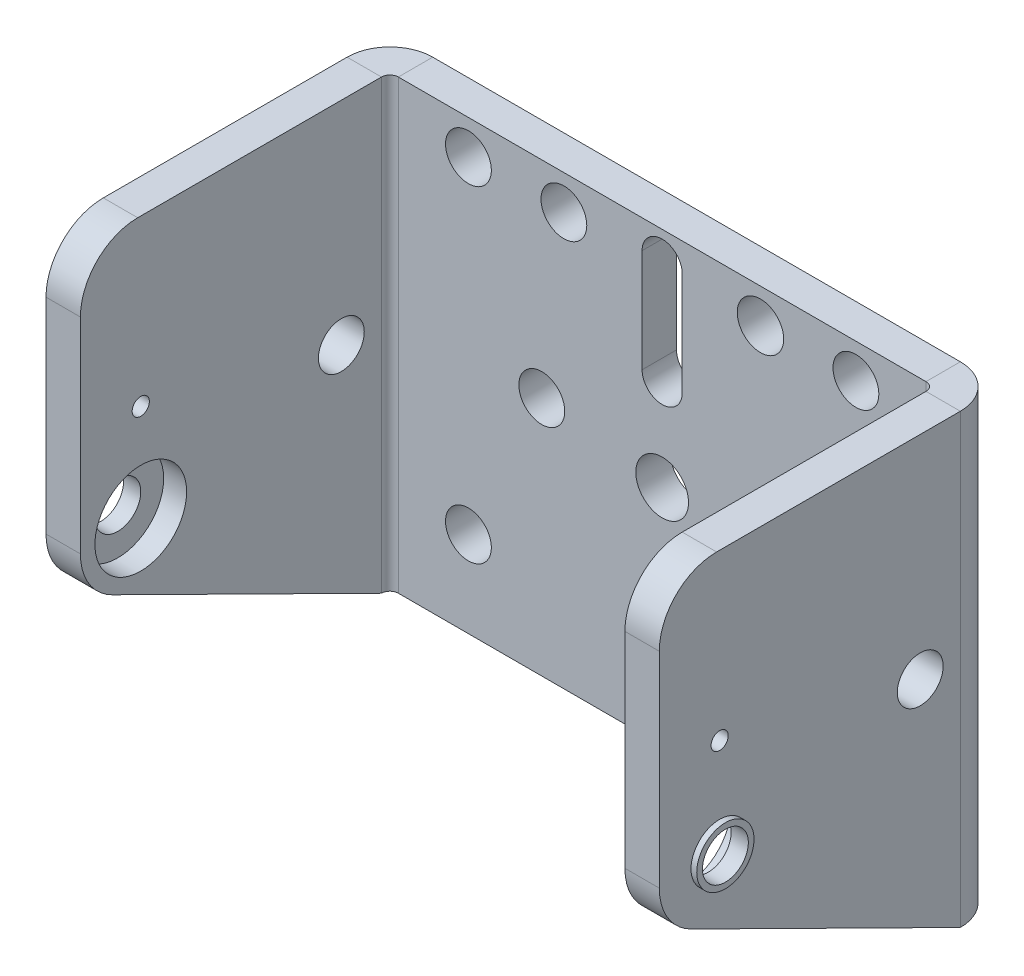
from build123d import *

# Parameters (mm, degrees)
ESBO_O1_W                        = 47.5
ESBO_O1_H                        = 39
FLANGE_BASE1_DEPTH               = 3
ESBO_O6_R                        = 2.3
CORTE_EXTRUS_O1_DEPTH            = 10
ARESTA_FLANGE1_STRIP_W           = 13.4732
ARESTA_FLANGE1_STRIP_H           = 3
ARESTA_FLANGE1_STRIP_CUT_DEPTH   = 39
ARESTA_FLANGE1_STRIP_2_W         = 13.4732
ARESTA_FLANGE1_STRIP_2_H         = 3
ARESTA_FLANGE1_STRIP_CUT_2_DEPTH = 39
ARESTA_FLANGE1_DEPTH             = 39
ARESTA_FLANGE1_BEND_DEPTH        = 39
ESBO_O13_R                       = 2
ESBO_O13_R_2                     = 0.75
CORTE_EXTRUS_O2_DEPTH            = 70
FILETE1_R                        = 5
ESBO_O14_R                       = 1.997873176
ESBO_O14_R_2                     = 2.026064888
ESBO_O14_R_3                     = 2
CORTE_EXTRUS_O4_DEPTH            = 3
BOSS_EXTRUDE1_START              = 0.5
SKETCH1_R                        = 2.5
SKETCH1_R_2                      = 2
BOSS_EXTRUDE1_DEPTH              = 0.5
SKETCH2_R                        = 4
CUT_EXTRUDE8_DEPTH               = 2
CORTE_EXTRUS_O5_REACH            = 66.966
ESBO_O15_R                       = 2


# Sheet-metal steps are written as plain solids
with BuildPart() as part:
    # Esboço1 → Flange-base1 (new body)
    with BuildSketch(Plane.XY):
        with Locations((3.243735783, -4.490936556)):
            Rectangle(ESBO_O1_W, ESBO_O1_H)
    extrude(amount=-FLANGE_BASE1_DEPTH)

    # Esboço6 → Corte-extrusão1 (cut)
    with BuildSketch(Plane.XY):
        with BuildLine():
            Line((-13.656264217, 10.009063444), (-13.656264217, 12.009063444))
            Line((-13.656264217, 12.009063444), (-11.656264217, 12.009063444))
            ThreePointArc((-11.656264217, 12.009063444), (-15.070477779, 13.423277006), (-13.656264217, 10.009063444))
        make_face()
        with BuildLine():
            Line((-11.656264217, 12.009063444), (-13.656264217, 12.009063444))
            Line((-13.656264217, 12.009063444), (-13.656264217, 10.009063444))
            ThreePointArc((-13.656264217, 10.009063444), (-12.242050654, 10.594849882), (-11.656264217, 12.009063444))
        make_face()
        with BuildLine():
            ThreePointArc((-11.656264217, -16.490936556), (-12.242050654, -15.076722994), (-13.656264217, -14.490936556))
            Line((-13.656264217, -14.490936556), (-13.656264217, -16.490936556))
            Line((-13.656264217, -16.490936556), (-11.656264217, -16.490936556))
        make_face()
        with BuildLine():
            Line((-13.656264217, -16.490936556), (-13.656264217, -14.490936556))
            ThreePointArc((-13.656264217, -14.490936556), (-15.070477779, -17.905150118), (-11.656264217, -16.490936556))
            Line((-11.656264217, -16.490936556), (-13.656264217, -16.490936556))
        make_face()
        with Locations((3.243735783, -4.490936556)):
            Circle(ESBO_O6_R)
        with BuildLine():
            Line((4.993735783, 12.009063444), (1.493735783, 12.009063444))
            Line((1.493735783, 12.009063444), (1.493735783, 3.523823043))
            ThreePointArc((1.493735783, 3.523823043), (3.243735783, 1.773823043), (4.993735783, 3.523823043))
            Line((4.993735783, 3.523823043), (4.993735783, 12.009063444))
        make_face()
        with BuildLine():
            Line((1.493735783, 12.523823043), (1.493735783, 12.009063444))
            Line((1.493735783, 12.009063444), (4.993735783, 12.009063444))
            Line((4.993735783, 12.009063444), (4.993735783, 12.523823043))
            ThreePointArc((4.993735783, 12.523823043), (3.243735783, 14.273823043), (1.493735783, 12.523823043))
        make_face()
        with BuildLine():
            Line((1.493735783, -12.505696155), (1.493735783, -16.490936556))
            Line((1.493735783, -16.490936556), (4.993735783, -16.490936556))
            Line((4.993735783, -16.490936556), (4.993735783, -12.505696155))
            ThreePointArc((4.993735783, -12.505696155), (3.243735783, -10.755696155), (1.493735783, -12.505696155))
        make_face()
        with BuildLine():
            Line((4.993735783, -16.490936556), (1.493735783, -16.490936556))
            Line((1.493735783, -16.490936556), (1.493735783, -21.505696155))
            ThreePointArc((1.493735783, -21.505696155), (3.243735783, -23.255696155), (4.993735783, -21.505696155))
            Line((4.993735783, -21.505696155), (4.993735783, -16.490936556))
        make_face()
        with BuildLine():
            ThreePointArc((22.143735783, -16.490936556), (21.557949346, -15.076722994), (20.143735783, -14.490936556))
            Line((20.143735783, -14.490936556), (20.143735783, -16.490936556))
            Line((20.143735783, -16.490936556), (18.143735783, -16.490936556))
            ThreePointArc((18.143735783, -16.490936556), (20.143735783, -18.490936556), (22.143735783, -16.490936556))
        make_face()
        with BuildLine():
            Line((20.143735783, -16.490936556), (20.143735783, -14.490936556))
            ThreePointArc((20.143735783, -14.490936556), (18.729522221, -15.076722994), (18.143735783, -16.490936556))
            Line((18.143735783, -16.490936556), (20.143735783, -16.490936556))
        make_face()
        with BuildLine():
            ThreePointArc((22.143735783, 12.009063444), (20.143735783, 14.009063444), (18.143735783, 12.009063444))
            Line((18.143735783, 12.009063444), (20.143735783, 12.009063444))
            Line((20.143735783, 12.009063444), (20.143735783, 10.009063444))
            ThreePointArc((20.143735783, 10.009063444), (21.557949346, 10.594849882), (22.143735783, 12.009063444))
        make_face()
        with BuildLine():
            Line((20.143735783, 12.009063444), (18.143735783, 12.009063444))
            ThreePointArc((18.143735783, 12.009063444), (18.729522221, 10.594849882), (20.143735783, 10.009063444))
            Line((20.143735783, 10.009063444), (20.143735783, 12.009063444))
        make_face()
    extrude(amount=-CORTE_EXTRUS_O1_DEPTH, mode=Mode.SUBTRACT)

    # Aresta-Flange1 strip (across the edge) → Aresta-Flange1 strip cut (cut)
    with BuildSketch(Plane(origin=(26.993735783, -23.990936556, 0), x_dir=(-1, 0, 0), z_dir=(0, 1, 0))):
        with Locations((-6, -1.5)):
            Rectangle(ARESTA_FLANGE1_STRIP_W, ARESTA_FLANGE1_STRIP_H)
    extrude(amount=ARESTA_FLANGE1_STRIP_CUT_DEPTH, mode=Mode.SUBTRACT)

    # Aresta-Flange1 strip 2 (across the edge) → Aresta-Flange1 strip cut 2 (cut)
    with BuildSketch(Plane(origin=(-20.506264217, 15.009063444, 0), x_dir=(1, 0, 0), z_dir=(0, -1, 0))):
        with Locations((-6, -1.5)):
            Rectangle(ARESTA_FLANGE1_STRIP_2_W, ARESTA_FLANGE1_STRIP_2_H)
    extrude(amount=ARESTA_FLANGE1_STRIP_CUT_2_DEPTH, mode=Mode.SUBTRACT)

    # Aresta-Flange1 section (across the edge) → Aresta-Flange1 (add)
    with BuildSketch(Plane(origin=(26.993735783, -23.990936556, 0), x_dir=(-1, 0, 0), z_dir=(0, 1, 0))):
        with BuildLine():
            Line((-3, 0.7366), (-3, 27))
            Line((-3, 27), (0, 27))
            Line((0, 27), (0, 0.7366))
            ThreePointArc((0, 0.7366), (0.215745145, 0.215745145), (0.7366, 0))
            Line((0.7366, 0), (0.7366, -3))
            ThreePointArc((0.7366, -3), (-1.905575199, -1.905575199), (-3, 0.7366))
        make_face()
    extrude(amount=ARESTA_FLANGE1_DEPTH)

    # Aresta-Flange1 section 2 (across the edge) → Aresta-Flange1 bend (add)
    with BuildSketch(Plane(origin=(-20.506264217, 15.009063444, 0), x_dir=(1, 0, 0), z_dir=(0, -1, 0))):
        with BuildLine():
            Line((-3, 0.7366), (-3, 27))
            Line((-3, 27), (0, 27))
            Line((0, 27), (0, 0.7366))
            ThreePointArc((0, 0.7366), (0.215745145, 0.215745145), (0.7366, 0))
            Line((0.7366, 0), (0.7366, -3))
            ThreePointArc((0.7366, -3), (-1.905575199, -1.905575199), (-3, 0.7366))
        make_face()
    extrude(amount=ARESTA_FLANGE1_BEND_DEPTH)

    # Esboço13 → Corte-extrusão2 (cut)
    with BuildSketch(Plane.ZY.offset(23.506264217)):
        with Locations((21.734737, -7.820936556)):
            Circle(ESBO_O13_R)
        with Locations((21.734737, 0.629063444)):
            Circle(ESBO_O13_R_2)
        Polygon((0.7366, -23.990936556), (27, -23.990936556), (27, -10.990936556), align=None)
    extrude(amount=-CORTE_EXTRUS_O2_DEPTH, mode=Mode.SUBTRACT)

    # Filete1
    filete1_edges = [part.edges().sort_by_distance(p)[0] for p in [
        (28.493735783, 15.009063444, 27),
        (-22.006264217, 15.009063444, 27),
        (-22.006264217, -10.990936556, 27),
        (28.493735783, -10.990936556, 27),
    ]]
    fillet(filete1_edges, radius=FILETE1_R)

    # Esboço14 → Corte-extrusão4 (cut)
    with BuildSketch(Plane.XY):
        with Locations((-5.331264217, 12.009063444)):
            Circle(ESBO_O14_R)
        with Locations((11.818735783, 12.009063444)):
            Circle(ESBO_O14_R_2)
        with Locations((13.743735783, -2.990936556)):
            Circle(ESBO_O14_R_3)
        with Locations(Location((-7.256264217, -2.990936556, 0), (0, 0, 180))):
            Circle(ESBO_O14_R_3)
    extrude(amount=-CORTE_EXTRUS_O4_DEPTH, mode=Mode.SUBTRACT)

    # Sketch1 → Boss-Extrude1 (add)
    with BuildSketch(Plane.ZY.offset(23.506264217).offset(BOSS_EXTRUDE1_START)):
        with Locations(Location((21.734737, -7.820936556, 0), (0, 0, 180))):
            Circle(SKETCH1_R)
        with Locations((21.734737, -7.820936556)):
            Circle(SKETCH1_R_2, mode=Mode.SUBTRACT)
    boss_extrude1 = extrude(amount=-BOSS_EXTRUDE1_DEPTH)

    # Sketch2 → Cut-Extrude8 (cut)
    with BuildSketch(Plane(origin=(-20.506264217, 0, 0), x_dir=(0, 0, -1), z_dir=(1, 0, 0))):
        with Locations((-21.734737, -7.820936556)):
            Circle(SKETCH2_R)
    cut_extrude8 = extrude(amount=-CUT_EXTRUDE8_DEPTH, mode=Mode.SUBTRACT)

    # Mirror1: Boss-Extrude1, Cut-Extrude8 across plane
    add(boss_extrude1.mirror(Plane.ZY.offset(-3.243735783)))
    add(cut_extrude8.mirror(Plane.ZY.offset(-3.243735783)), mode=Mode.SUBTRACT)

    # Corte-extrusão5: up to this face of the body (flat: up to its plane)
    corte_extrus_o5_end = Plane(part.part.faces().sort_by_distance((-23.506264217, -1.392336246, 12.655784695))[0])
    # Esboço15 → Corte-extrusão5 (cut, up to the picked face)
    with BuildSketch(Plane(origin=(29.993735783, 0, 0), x_dir=(0, 0, -1), z_dir=(1, 0, 0)), mode=Mode.PRIVATE) as corte_extrus_o5_sk1:
        with Locations((-4.2366, -3.490936556)):
            Circle(ESBO_O15_R)
    corte_extrus_o5_tool1 = split(extrude(corte_extrus_o5_sk1.sketch, amount=-CORTE_EXTRUS_O5_REACH, mode=Mode.PRIVATE), bisect_by=corte_extrus_o5_end, keep=Keep.BOTH, mode=Mode.PRIVATE)
    add(corte_extrus_o5_tool1.solids().sort_by(Axis((29.993736, -3.490937, 4.2366), (-1, 0, 0)))[0], mode=Mode.SUBTRACT)


solid = part.part
